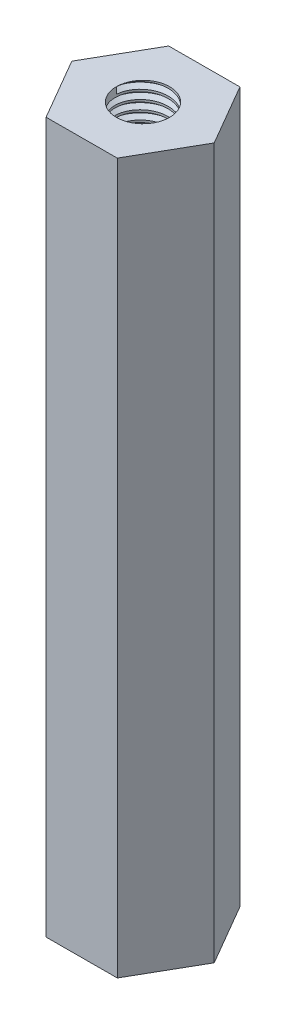
from build123d import *
from build123d.topology import SkipClean

# Parameters (mm, degrees)
EXTRUDE_1_DEPTH     = 40
SKETCH_2_R          = 1.5
CUT_EXTRUDE_1_DEPTH = 10
CUT_EXTRUDE_START   = -10
SKETCH_3_R          = 1.5
CUT_EXTRUDE_2_DEPTH = 10
THREAD_1_PITCH      = 0.5
THREAD_2_PITCH      = 0.5


with BuildPart() as part:
    # Sketch 1 → 凸台-拉伸1 (new body)
    with BuildSketch(Plane(origin=(0, 0, 0), x_dir=(1, 0, 0), z_dir=(0, 1, 0))):
        Polygon((2.009841429, -3.458419663), (4, 0.011363904), (1.990158571, 3.469783567), (-2.009841429, 3.458419663), (-4, -0.011363904), (-1.990158571, -3.469783567), align=None)
    extrude(amount=EXTRUDE_1_DEPTH)

    # Sketch 2 → 切除-拉伸1 (cut)
    with BuildSketch(Plane.XZ):
        with Locations(Location((0, 0, 0), (0, 0, 270))):
            Circle(SKETCH_2_R)
    extrude(amount=-CUT_EXTRUDE_1_DEPTH, mode=Mode.SUBTRACT)

    # 草图3 → 切除-拉伸2 (cut)
    with BuildSketch(Plane(origin=(0, 40, 0), x_dir=(1, 0, 0), z_dir=(0, 1, 0)).offset(CUT_EXTRUDE_START)):
        with Locations(Location((0, 0, 0), (0, 0, 90))):
            Circle(SKETCH_3_R)
    extrude(amount=CUT_EXTRUDE_2_DEPTH, mode=Mode.SUBTRACT)

    # 螺纹线1: the profile of Sketch 1 2 profile screwed along a right-hand helix of 16 turns, 6 arcs to a turn; built about Z, then put on its axis
    with SkipClean():  # the faces are left unmerged after this step: merging them gives an invalid solid
        thread_1_z = Axis((0, 0, 0), (0, 0, 1))
        thread_1_corners = [(1.4997, 0, -0.000173205), (1.770632938, 0, 0.156249999), (1.770632938, 0, 0.218749999), (1.4997, 0, 0.375173204)]
        with BuildLine(mode=Mode.PRIVATE) as thread_1_profile:
            Line(thread_1_corners[0], thread_1_corners[1])
            Line(thread_1_corners[1], thread_1_corners[2])
            Line(thread_1_corners[2], thread_1_corners[3])
            Line(thread_1_corners[3], thread_1_corners[0])
        thread_1_cap = Face(thread_1_profile.wire())
        thread_1_turn_angles = [0, 30, 60, 90, 120, 150, 180, 210, 240, 270, 300, 330, 360]
        thread_1_turn_weights = [1, 0.8660254037844387, 1, 0.8660254037844387, 1, 0.8660254037844387, 1, 0.8660254037844387, 1, 0.8660254037844387, 1, 0.8660254037844387, 1]
        thread_1_turn_rails = [Edge.make_bspline([Vector(p[0], p[1], 0).rotate(thread_1_z, thread_1_turn_angles[k]) / thread_1_turn_weights[k] + Vector(0, 0, p[2] + THREAD_1_PITCH * thread_1_turn_angles[k] / 360) for k in range(13)], [0, 0, 0, 1, 1, 2, 2, 3, 3, 4, 4, 5, 5, 6, 6, 6], 2, thread_1_turn_weights) for p in thread_1_corners]
        thread_1_turn_sides = [Face.make_surface_from_curves(thread_1_turn_rails[p[0]], thread_1_turn_rails[p[1]]) for p in [(0, 1), (1, 2), (2, 3), (3, 0)]]
        thread_1 = Plane(origin=(0, 0, 0), x_dir=(1, 0, 0), z_dir=(0, 1, 0)) * Solid(Shell([*[p.moved(Location((0, 0, THREAD_1_PITCH * i))) for i in range(16) for p in thread_1_turn_sides], thread_1_cap, thread_1_cap.rotate(thread_1_z, 5760).moved(Location((0, 0, THREAD_1_PITCH * 5760 / 360)))]))
        add(thread_1, mode=Mode.SUBTRACT)

    # 螺纹线2: the profile of Sketch 2 2 profile screwed along a right-hand helix of 16 turns, 6 arcs to a turn; built about Z, then put on its axis
    with SkipClean():  # the faces are left unmerged after this step: merging them gives an invalid solid
        thread_2_z = Axis((0, 0, 0), (0, 0, 1))
        thread_2_corners = [(1.4997, 0, -0.000173205), (1.770632938, 0, 0.156249999), (1.770632938, 0, 0.218749999), (1.4997, 0, 0.375173204)]
        with BuildLine(mode=Mode.PRIVATE) as thread_2_profile:
            Line(thread_2_corners[0], thread_2_corners[1])
            Line(thread_2_corners[1], thread_2_corners[2])
            Line(thread_2_corners[2], thread_2_corners[3])
            Line(thread_2_corners[3], thread_2_corners[0])
        thread_2_cap = Face(thread_2_profile.wire())
        thread_2_turn_angles = [0, 30, 60, 90, 120, 150, 180, 210, 240, 270, 300, 330, 360]
        thread_2_turn_weights = [1, 0.8660254037844387, 1, 0.8660254037844387, 1, 0.8660254037844387, 1, 0.8660254037844387, 1, 0.8660254037844387, 1, 0.8660254037844387, 1]
        thread_2_turn_rails = [Edge.make_bspline([Vector(p[0], p[1], 0).rotate(thread_2_z, thread_2_turn_angles[k]) / thread_2_turn_weights[k] + Vector(0, 0, p[2] + THREAD_2_PITCH * thread_2_turn_angles[k] / 360) for k in range(13)], [0, 0, 0, 1, 1, 2, 2, 3, 3, 4, 4, 5, 5, 6, 6, 6], 2, thread_2_turn_weights) for p in thread_2_corners]
        thread_2_turn_sides = [Face.make_surface_from_curves(thread_2_turn_rails[p[0]], thread_2_turn_rails[p[1]]) for p in [(0, 1), (1, 2), (2, 3), (3, 0)]]
        thread_2 = Plane(origin=(0, 40, 0), x_dir=(-1, 0, 0), z_dir=(0, -1, 0)) * Solid(Shell([*[p.moved(Location((0, 0, THREAD_2_PITCH * i))) for i in range(16) for p in thread_2_turn_sides], thread_2_cap, thread_2_cap.rotate(thread_2_z, 5760).moved(Location((0, 0, THREAD_2_PITCH * 5760 / 360)))]))
        add(thread_2, mode=Mode.SUBTRACT)


solid = part.part
